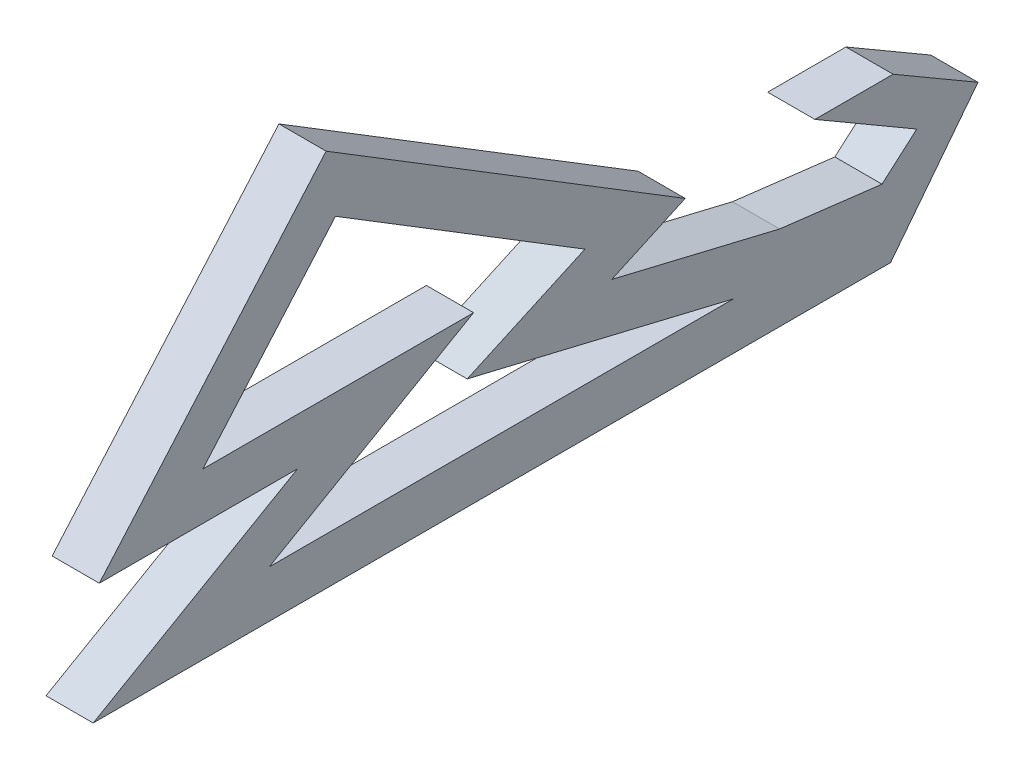
from build123d import *

# Parameters (mm, degrees)
BOSS_EXTRUDE1_DEPTH = 10


with BuildPart() as part:
    # Sketch1 → Boss-Extrude1 (new body)
    with BuildSketch(Plane(origin=(0, 0, 0), x_dir=(0, 0, -1), z_dir=(1, 0, 0))):
        Polygon((-84.5, 0), (84.5, 0), (103.022719545, 23.837300471), (85.030260907, 34.310612808), (68.447971676, 34.310612808), (90.040764412, 21.74156557), (82.681145031, 15.308049564), (60.981390778, 17.938421548), (25.397151726, 26.463858382), (40.973979992, 33.546078163), (-35.136536454, 80.278852256), (-83.198729811, 25), (-41.198729811, 25), align=None)
        Polygon((19.714317813, 34.865156554), (-5.237525753, 23.520456782), (51.195379163, 10), (-47.179491924, 10), (-3.878221735, 35), (-61.253030143, 35), (-33.149028439, 67.323888061), align=None, mode=Mode.SUBTRACT)
    extrude(amount=BOSS_EXTRUDE1_DEPTH)


solid = part.part
